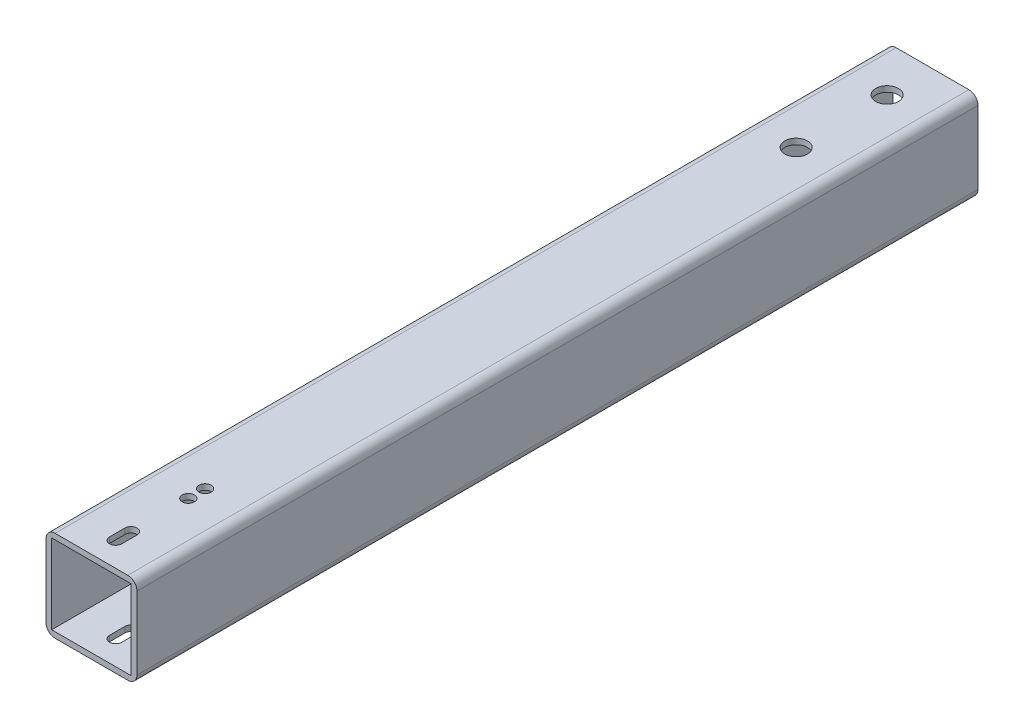
from build123d import *

# Parameters (mm, degrees)
SKETCH1_W               = 25.4
SKETCH1_H               = 25.4
SKETCH1_W_2             = 22.225
SKETCH1_H_2             = 22.225
BOSS_EXTRUDE1_DEPTH     = 234.95
FILLET1_R               = 2.54
SKETCH2_R               = 3.175
CUT_EXTRUDE1_DEPTH      = 238.560919126
CUT_EXTRUDE2_DEPTH      = 238.560919126
CUT_EXTRUDE2_DEPTH_BACK = 238.560919126
SKETCH3_R               = 1.7


with BuildPart() as part:
    # Sketch1 → Boss-Extrude1 (new body)
    with BuildSketch(Plane.XY):
        with Locations((-11.559591837, -1.275183673)):
            Rectangle(SKETCH1_W, SKETCH1_H)
        with Locations((-11.559591837, -1.275183673)):
            Rectangle(SKETCH1_W_2, SKETCH1_H_2, mode=Mode.SUBTRACT)
    extrude(amount=BOSS_EXTRUDE1_DEPTH)

    # Fillet1
    fillet1_edges = [part.edges().sort_by_distance(p)[0] for p in [
        (1.140408163, -13.975183673, 117.475),
        (-24.259591837, -13.975183673, 117.475),
        (-24.259591837, 11.424816327, 117.475),
        (1.140408163, 11.424816327, 117.475),
    ]]
    fillet(fillet1_edges, radius=FILLET1_R)

    # Sketch2 → Cut-Extrude1 (cut, through all)
    with BuildSketch(Plane(origin=(0, 11.424816327, 0), x_dir=(1, 0, 0), z_dir=(0, 1, 0))):
        with Locations((-11.559591837, -12.7)):
            Circle(SKETCH2_R)
        with Locations((-11.559591837, -38.1)):
            Circle(SKETCH2_R)
    extrude(amount=-CUT_EXTRUDE1_DEPTH, mode=Mode.SUBTRACT)

    # Sketch3 → Cut-Extrude2 (cut, two sides: drawn at the far end of the back side and taken through both)
    with BuildSketch(Plane(origin=(0, 11.424816327, 0), x_dir=(1, 0, 0), z_dir=(0, 1, 0)).offset(-CUT_EXTRUDE2_DEPTH_BACK)):
        with Locations((-11.559591837, -207.9)):
            Circle(SKETCH3_R)
        with Locations((-11.559591837, -203.19501094)):
            Circle(SKETCH3_R)
        with BuildLine():
            Line((-9.859591837, -223.9), (-9.859591837, -228.19501094))
            ThreePointArc((-9.859591837, -228.19501094), (-11.559591837, -229.89501094), (-13.259591837, -228.19501094))
            Line((-13.259591837, -228.19501094), (-13.259591837, -223.9))
            ThreePointArc((-13.259591837, -223.9), (-11.559591837, -222.2), (-9.859591837, -223.9))
        make_face()
    extrude(amount=CUT_EXTRUDE2_DEPTH + CUT_EXTRUDE2_DEPTH_BACK, mode=Mode.SUBTRACT)


solid = part.part
